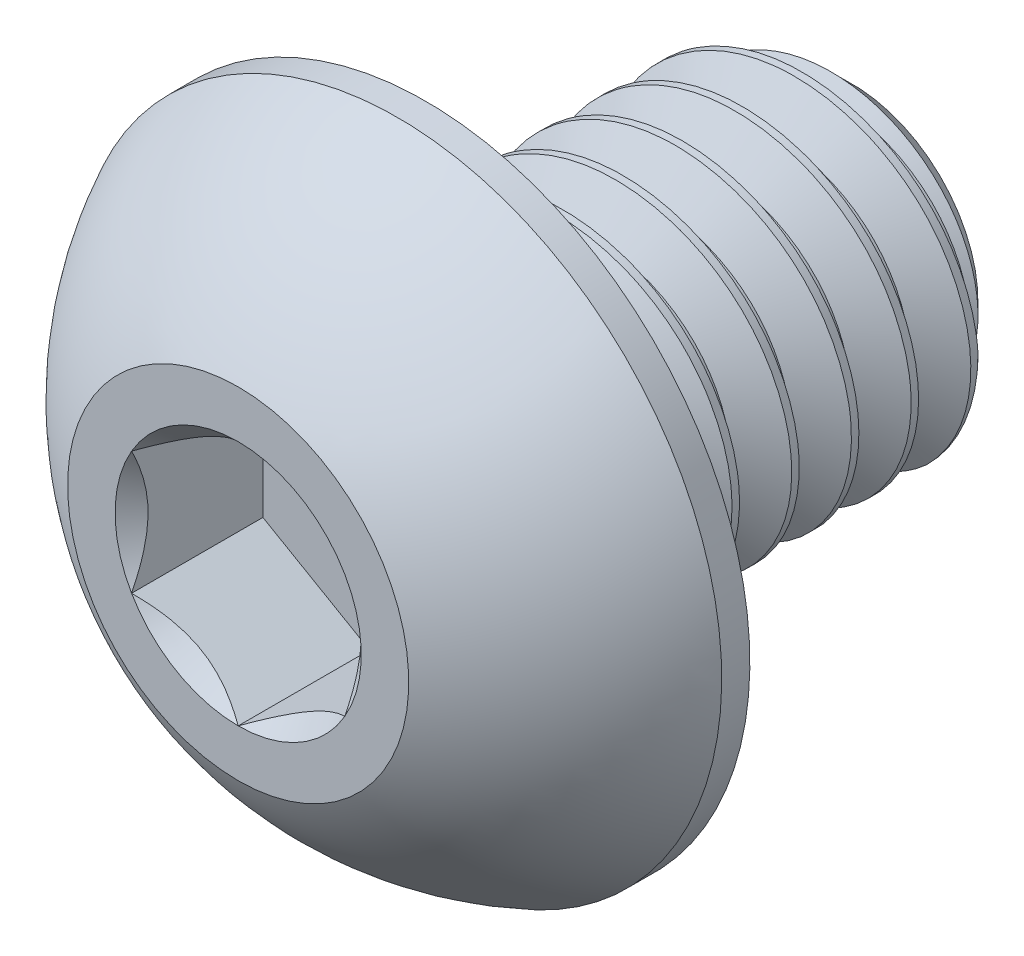
from build123d import *

# Parameters (mm, degrees)
CUT_EXTRUDE2_DEPTH = 1.54
CUT_SWEEP2_PITCH   = 0.7


# Read off the part's stored shape, not the designer's step: Split1
with BuildPart() as part:
    # Sketch10 → Revolve3 (revolve)
    with BuildSketch(Plane(origin=(0, 0, 0), x_dir=(0, 0, -1), z_dir=(1, 0, 0)), mode=Mode.PRIVATE) as revolve3_sk:
        Polygon((1.975, 2), (2.5, 1.475), (2.5, 0), (-2.5, 0), (-2.5, 2), align=None)
    revolve(revolve3_sk.sketch.rotate(Axis((0, 0, 4.7), (0, 0, -1)), 180), axis=Axis((0, 0, 4.7), (0, 0, -1)))

    # Sketch7 → Revolve2 (revolve)
    with BuildSketch(Plane(origin=(0, 0, 0), x_dir=(0, 0, -1), z_dir=(1, 0, 0)), mode=Mode.PRIVATE) as revolve2_sk:
        with BuildLine():
            Line((-2.83, 3.8), (-2.5, 3.8))
            Line((-2.5, 3.8), (-2.5, 0))
            Line((-2.5, 0), (-4.7, 0))
            Line((-4.7, 0), (-4.7, 2))
            ThreePointArc((-4.7, 2), (-3.906499853, 3.047002626), (-2.83, 3.8))
        make_face()
    revolve(revolve2_sk.sketch.rotate(Axis((0, 0, 4.7), (0, 0, -1)), 180), axis=Axis((0, 0, 4.7), (0, 0, -1)))

    # Sketch5 → Cut-Extrude2 (cut)
    with BuildSketch(Plane.XY.offset(4.7)):
        Polygon((1.25, -0.721687836), (1.25, 0.721687836), (0, 1.443375673), (-1.25, 0.721687836), (-1.25, -0.721687836), (0, -1.443375673), align=None)
    extrude(amount=-CUT_EXTRUDE2_DEPTH, mode=Mode.SUBTRACT)

    # Cut-Extrude3 cone 1 section (through the dimple's axis) → Cut-Extrude3 (revolve, cut)
    with BuildSketch(Plane(origin=(0, 0, 4.7), x_dir=(0, -1, 0), z_dir=(1, 0, 0))):
        Polygon((0, 0), (1.443375673, 0), (0, 1.443375673), align=None)
    revolve(axis=Axis((0, 0, 4.7), (0, 0, -1)), mode=Mode.SUBTRACT)


with BuildPart() as body_2:
    # Split1: the piece on the far side of the plane
    add(part.part)
    split(bisect_by=Plane.XY.offset(2.5), keep=Keep.BOTTOM)

    # Cut-Sweep2: the profile of Sketch12 screwed along a right-hand helix of 10.285714 turns, 6 arcs to a turn; built about Z, then put on its axis
    cut_sweep2_z = Axis((0, 0, 0), (0, 0, 1))
    cut_sweep2_corners = [(1.545336663, 0, -0.2625), (1.545336663, 0, -0.35), (2.037888611, 0, -0.634375), (2.037888611, 0, 0.021875)]
    with BuildLine(mode=Mode.PRIVATE) as cut_sweep2_profile:
        Line(cut_sweep2_corners[0], cut_sweep2_corners[1])
        Line(cut_sweep2_corners[1], cut_sweep2_corners[2])
        Line(cut_sweep2_corners[2], cut_sweep2_corners[3])
        Line(cut_sweep2_corners[3], cut_sweep2_corners[0])
    cut_sweep2_cap = Face(cut_sweep2_profile.wire())
    cut_sweep2_turn_angles = [0, 30, 60, 90, 120, 150, 180, 210, 240, 270, 300, 330, 360]
    cut_sweep2_turn_weights = [1, 0.8660254037844387, 1, 0.8660254037844387, 1, 0.8660254037844387, 1, 0.8660254037844387, 1, 0.8660254037844387, 1, 0.8660254037844387, 1]
    cut_sweep2_turn_rails = [Edge.make_bspline([Vector(p[0], p[1], 0).rotate(cut_sweep2_z, cut_sweep2_turn_angles[k]) / cut_sweep2_turn_weights[k] + Vector(0, 0, p[2] + CUT_SWEEP2_PITCH * cut_sweep2_turn_angles[k] / 360) for k in range(13)], [0, 0, 0, 1, 1, 2, 2, 3, 3, 4, 4, 5, 5, 6, 6, 6], 2, cut_sweep2_turn_weights) for p in cut_sweep2_corners]
    cut_sweep2_turn_sides = [Face.make_surface_from_curves(cut_sweep2_turn_rails[p[0]], cut_sweep2_turn_rails[p[1]]) for p in [(0, 1), (1, 2), (2, 3), (3, 0)]]
    cut_sweep2_turn = Solid(Shell([*cut_sweep2_turn_sides, cut_sweep2_cap, cut_sweep2_cap.rotate(cut_sweep2_z, 360).moved(Location((0, 0, CUT_SWEEP2_PITCH * 360 / 360)))]))
    cut_sweep2_last_angles = [3600, 3630, 3660, 3681.428571429, 3702.857142857]
    cut_sweep2_last_weights = [1, 0.8660254037844387, 1, 0.9308737486441222, 1]
    cut_sweep2_last_rails = [Edge.make_bspline([Vector(p[0], p[1], 0).rotate(cut_sweep2_z, cut_sweep2_last_angles[k]) / cut_sweep2_last_weights[k] + Vector(0, 0, p[2] + CUT_SWEEP2_PITCH * cut_sweep2_last_angles[k] / 360) for k in range(5)], [0, 0, 0, 1, 1, 2, 2, 2], 2, cut_sweep2_last_weights) for p in cut_sweep2_corners]
    cut_sweep2_last_sides = [Face.make_surface_from_curves(cut_sweep2_last_rails[p[0]], cut_sweep2_last_rails[p[1]]) for p in [(0, 1), (1, 2), (2, 3), (3, 0)]]
    cut_sweep2_last = Solid(Shell([*cut_sweep2_last_sides, cut_sweep2_cap.rotate(cut_sweep2_z, 3600).moved(Location((0, 0, CUT_SWEEP2_PITCH * 3600 / 360))), cut_sweep2_cap.rotate(cut_sweep2_z, 3702.857142857).moved(Location((0, 0, CUT_SWEEP2_PITCH * 3702.857142857 / 360)))]))
    cut_sweep2_each = [*[cut_sweep2_turn.moved(Location((0, 0, CUT_SWEEP2_PITCH * i))) for i in range(10)], cut_sweep2_last]
    add(Plane(origin=(0, 0, -2.5), x_dir=(0, 1, 0), z_dir=(0, 0, 1)) * Compound([cut_sweep2_each[i] for i in range(0, 11, 2)]), mode=Mode.SUBTRACT)
    add(Plane(origin=(0, 0, -2.5), x_dir=(0, 1, 0), z_dir=(0, 0, 1)) * Compound([cut_sweep2_each[i] for i in range(1, 11, 2)]), mode=Mode.SUBTRACT)


with BuildPart() as part_1:
    add(part.part)

    # Split1
    split(bisect_by=Plane.XY.offset(2.5), keep=Keep.TOP)

    add(body_2.part)  # Boss-Extrude1 merges body 2
    # Boss-Extrude1 cone 1 section (through the dimple's axis) → Boss-Extrude1 (revolve)
    with BuildSketch(Plane(origin=(0, 0, 2.5), x_dir=(0, -1, 0), z_dir=(1, 0, 0))):
        Polygon((0, 0), (2, 0), (0, 2), align=None)
    revolve(axis=Axis((0, 0, 2.5), (0, 0, -1)))


solid = part_1.part
